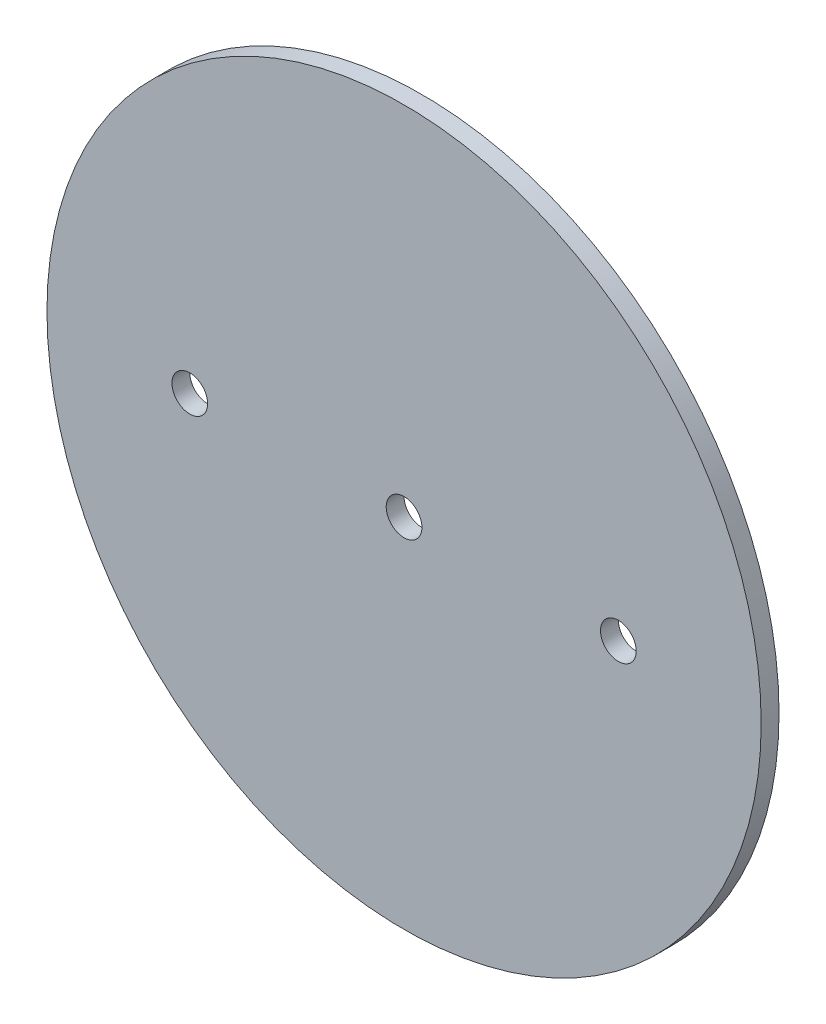
from build123d import *

# Parameters (mm, degrees)
SKETCH1_R                   = 63.5
BOSS_EXTRUDE1_DEPTH         = 1.5875
F_1_4_0_25_DIAMETER_HOLE1_D = 6.35


with BuildPart() as part:
    # Sketch1 → Boss-Extrude1 (new, symmetric)
    with BuildSketch(Plane.XY):
        Circle(SKETCH1_R)
    extrude(amount=BOSS_EXTRUDE1_DEPTH, both=True)

    # 1/4 (0.25) Diameter Hole1 (through all)
    with Locations(Plane.XY.offset(1.5875)):
        with Locations((-38.1, 0), (0, 0), (38.1, 0)):
            Hole(F_1_4_0_25_DIAMETER_HOLE1_D / 2)


solid = part.part
